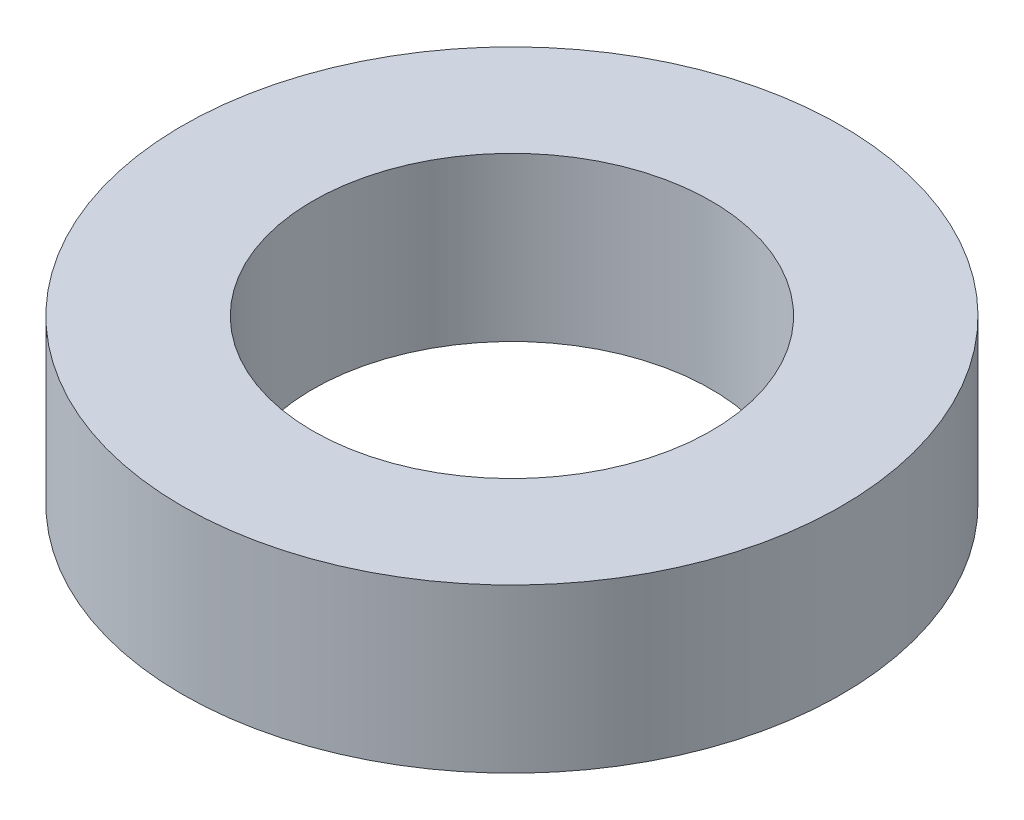
from build123d import *

# Parameters (mm, degrees)
SKETCH_1_R      = 18.2
SKETCH_1_R_2    = 11
EXTRUDE_1_DEPTH = 9


with BuildPart() as part:
    # Эскиз1 → Вытянуть1 (new body)
    with BuildSketch(Plane(origin=(0, 0, 0), x_dir=(1, 0, 0), z_dir=(0, 1, 0))):
        Circle(SKETCH_1_R)
        Circle(SKETCH_1_R_2, mode=Mode.SUBTRACT)
    extrude(amount=EXTRUDE_1_DEPTH)


solid = part.part
